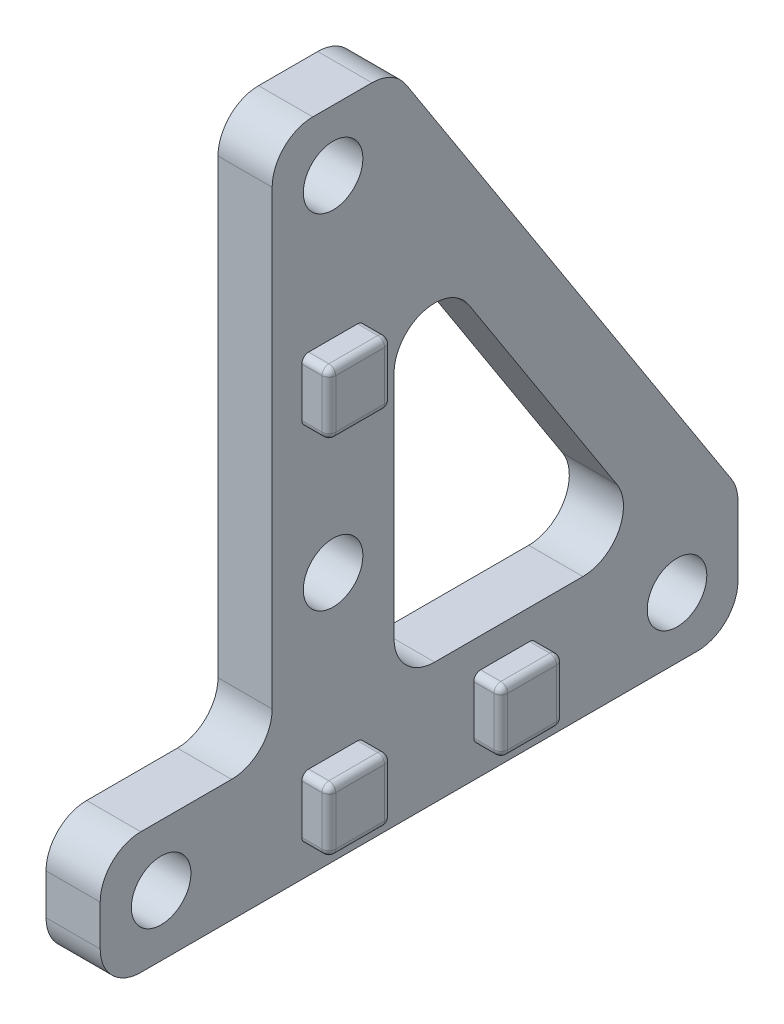
from build123d import *

# Parameters (mm, degrees)
SKETCH1_R           = 2.2
BOSS_EXTRUDE1_DEPTH = 4
FILLET1_R           = 3
SKETCH2_W           = 4.6228
SKETCH2_H           = 4.6228
BOSS_EXTRUDE2_DEPTH = 2
FILLET2_R           = 0.508
FILLET3_R           = 0.508


with BuildPart() as part:
    # Sketch1 → Boss-Extrude1 (new body)
    with BuildSketch(Plane(origin=(0, 0, 0), x_dir=(0, 0, -1), z_dir=(1, 0, 0))):
        Polygon((-4.5, 4.5), (-17.2, 4.5), (-17.2, -4.5), (29.9, -4.5), (29.9, 4.5), (4.5, 43.87), (-4.5, 43.87), align=None)
        with Locations((25.4, 0)):
            Circle(SKETCH1_R, mode=Mode.SUBTRACT)
        with Locations((0, 13.97)):
            Circle(SKETCH1_R, mode=Mode.SUBTRACT)
        with Locations((0, 39.37)):
            Circle(SKETCH1_R, mode=Mode.SUBTRACT)
        with Locations((-12.7, 0)):
            Circle(SKETCH1_R, mode=Mode.SUBTRACT)
        Polygon((4.5, 4.5), (23.949720405, 4.5), (4.5, 34.647066627), align=None, mode=Mode.SUBTRACT)
    extrude(amount=BOSS_EXTRUDE1_DEPTH)

    # Fillet1
    fillet1_edges = [part.edges().sort_by_distance(p)[0] for p in [
        (2, 4.5, 4.5),
        (2, -4.5, 17.2),
        (2, 4.5, 17.2),
        (2, -4.5, -29.9),
        (2, 4.5, -29.9),
        (2, 43.87, -4.5),
        (2, 43.87, 4.5),
        (2, 4.5, -4.5),
        (2, 4.5, -23.949720405),
        (2, 34.647066627, -4.5),
    ]]
    fillet(fillet1_edges, radius=FILLET1_R)

    # Sketch2 → Boss-Extrude2 (add)
    with BuildSketch(Plane(origin=(4, 0, 0), x_dir=(0, 0, -1), z_dir=(1, 0, 0))):
        Rectangle(SKETCH2_W, SKETCH2_H)
        with Locations((12.7, 0)):
            Rectangle(SKETCH2_W, SKETCH2_H)
        with Locations((0, 26.67)):
            Rectangle(SKETCH2_W, SKETCH2_H)
    extrude(amount=BOSS_EXTRUDE2_DEPTH)

    # Fillet2
    fillet2_edges = [part.edges().sort_by_distance(p)[0] for p in [
        (5, 2.3114, -15.0114),
        (5, 2.3114, -10.3886),
        (5, -2.3114, -10.3886),
        (5, -2.3114, -15.0114),
        (5, -2.3114, -2.3114),
        (5, 2.3114, -2.3114),
        (5, 2.3114, 2.3114),
        (5, -2.3114, 2.3114),
        (5, 28.9814, 2.3114),
        (5, 28.9814, -2.3114),
        (5, 24.3586, -2.3114),
        (5, 24.3586, 2.3114),
    ]]
    fillet(fillet2_edges, radius=FILLET2_R)

    # Fillet3
    fillet3_edges = [part.edges().sort_by_distance(p)[0] for p in [
        (6, -2.162610245, -10.537389755),
        (6, 0, -10.3886),
        (6, 2.162610245, -10.537389755),
        (6, 2.3114, -12.7),
        (6, 2.162610245, -14.862610245),
        (6, 0, -15.0114),
        (6, -2.162610245, -14.862610245),
        (6, -2.162610245, 2.162610245),
        (6, 0, 2.3114),
        (6, 2.162610245, 2.162610245),
        (6, 2.3114, 0),
        (6, 2.162610245, -2.162610245),
        (6, 0, -2.3114),
        (6, -2.162610245, -2.162610245),
        (6, 24.507389755, 2.162610245),
        (6, 26.67, 2.3114),
        (6, 28.832610245, 2.162610245),
        (6, 28.9814, 0),
        (6, 28.832610245, -2.162610245),
        (6, 26.67, -2.3114),
        (6, 24.507389755, -2.162610245),
        (6, -2.3114, -12.7),
        (6, -2.3114, 0),
        (6, 24.3586, 0),
    ]]
    fillet(fillet3_edges, radius=FILLET3_R)


solid = part.part
